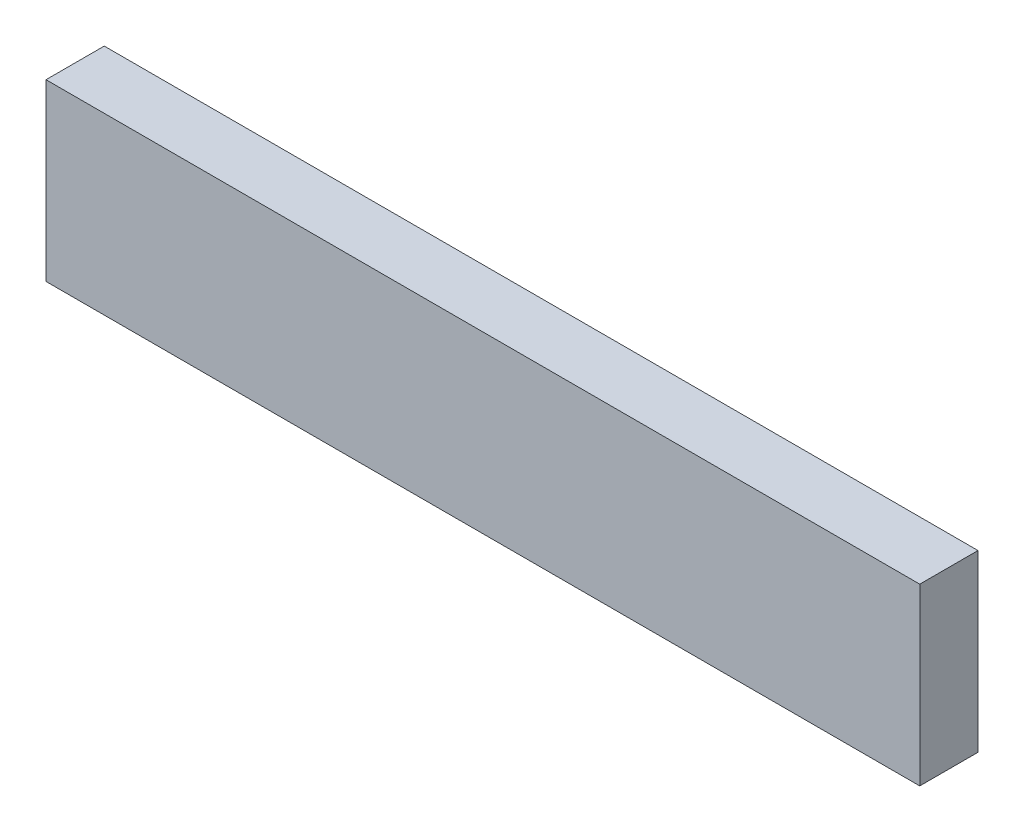
from build123d import *

# Parameters (mm, degrees)
SKETCH1_W           = 190.5
SKETCH1_H           = 38.1
BOSS_EXTRUDE1_DEPTH = 12.7


with BuildPart() as part:
    # Sketch1 → Boss-Extrude1 (new body)
    with BuildSketch(Plane.XY):
        Rectangle(SKETCH1_W, SKETCH1_H)
    extrude(amount=BOSS_EXTRUDE1_DEPTH)


solid = part.part
